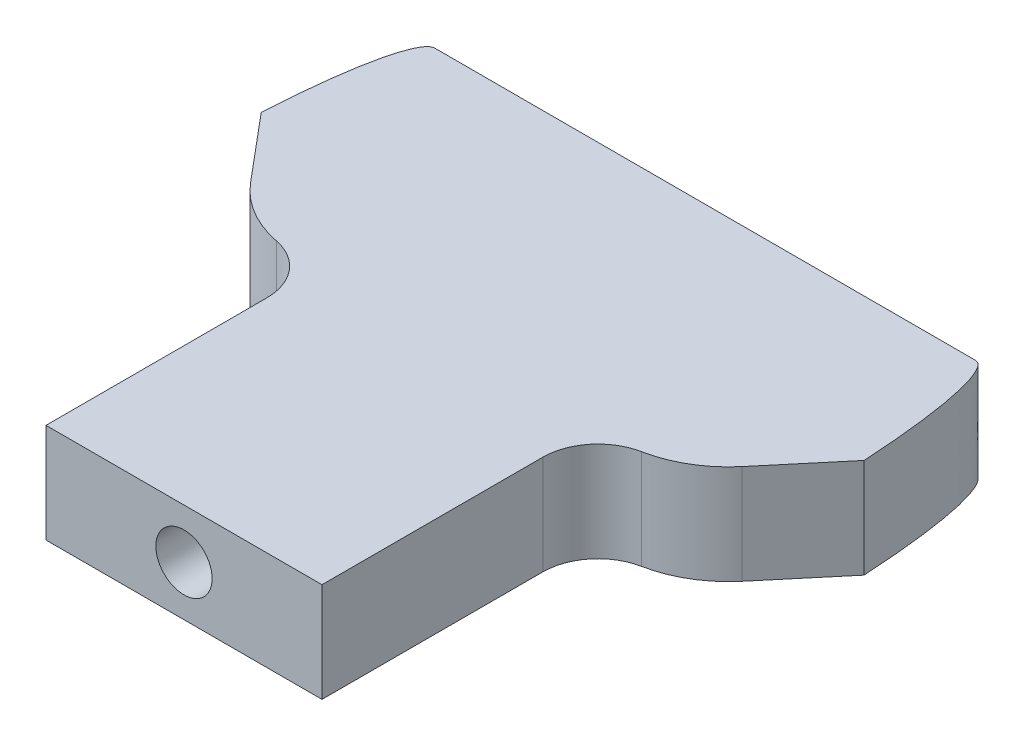
from build123d import *
from OCP.BRepFilletAPI import BRepFilletAPI_MakeChamfer

# Parameters (mm, degrees)
SKETCH2_W           = 55
SKETCH2_H           = 9
SKETCH2_R           = 2.55
BOSS_EXTRUDE1_DEPTH = 12.2
SKETCH3_W           = 55
SKETCH3_H           = 9
BOSS_EXTRUDE2_DEPTH = 35
CUT_EXTRUDE1_REACH  = 57.363
CHAMFER1_SIZE       = 8
CHAMFER1_SIZE2      = 9.534028741
FILLET1_SIZE        = 20
FILLET1_SIZE_2      = 3
FILLET2_R           = 10


with BuildPart() as part:
    # Sketch2 → Boss-Extrude1 (new body)
    with BuildSketch(Plane.XY):
        Rectangle(SKETCH2_W, SKETCH2_H)
        Circle(SKETCH2_R, mode=Mode.SUBTRACT)
    extrude(amount=-BOSS_EXTRUDE1_DEPTH)

    # Sketch3 → Boss-Extrude2 (add)
    with BuildSketch(Plane(origin=(0, 0, -12.2), x_dir=(-1, 0, 0), z_dir=(0, 0, -1))):
        Rectangle(SKETCH3_W, SKETCH3_H)
    extrude(amount=BOSS_EXTRUDE2_DEPTH)

    # Sketch5 → Cut-Extrude1 (cut, up to next)
    with BuildSketch(Plane.XZ.offset(4.5), mode=Mode.PRIVATE) as cut_extrude1_sk1:
        with BuildLine():
            Line((27.5, 0), (12.5, 0))
            Line((12.5, 0), (12.5, -20))
            ThreePointArc((12.5, -20), (13.964466094, -23.535533906), (17.5, -25))
            Line((17.5, -25), (27.5, -25))
            Line((27.5, -25), (27.5, 0))
        make_face()
    cut_extrude1_tool1 = extrude(cut_extrude1_sk1.sketch, amount=-CUT_EXTRUDE1_REACH, mode=Mode.PRIVATE) & part.part
    # Sketch5 → Cut-Extrude1 (cut, up to next)
    with BuildSketch(Plane.XZ.offset(4.5), mode=Mode.PRIVATE) as cut_extrude1_sk2:
        with BuildLine():
            Line((-12.5, 0), (-12.5, -20))
            ThreePointArc((-12.5, -20), (-13.964466094, -23.535533906), (-17.5, -25))
            Line((-17.5, -25), (-27.5, -25))
            Line((-27.5, -25), (-27.5, 0))
            Line((-27.5, 0), (-12.5, 0))
        make_face()
    cut_extrude1_tool2 = extrude(cut_extrude1_sk2.sketch, amount=-CUT_EXTRUDE1_REACH, mode=Mode.PRIVATE) & part.part
    add(cut_extrude1_tool1.solids().sort_by_distance((20.092648, -4.5, -12.33478))[0], mode=Mode.SUBTRACT)
    add(cut_extrude1_tool2.solids().sort_by_distance((-20.092648, -4.5, -12.33478))[0], mode=Mode.SUBTRACT)

    # Chamfer1: one chamfer whose edges measure the first distance from different faces: ONE call of the kernel's chamfer builder (chamfer() names one face for all edges)
    chamfer1_edges_1 = [part.edges().sort_by_distance(p)[0] for p in [
        (27.5, 0, -25),
    ]]
    chamfer1_side_1 = [part.faces().sort_by_distance(p)[0] for p in [
        (22.5, 0, -25),
    ]]
    chamfer1_edges_2 = [part.edges().sort_by_distance(p)[0] for p in [
        (-27.5, 0, -25),
    ]]
    chamfer1_side_2 = [part.faces().sort_by_distance(p)[0] for p in [
        (-22.5, 0, -25),
    ]]
    chamfer1 = BRepFilletAPI_MakeChamfer(part.part.solid().wrapped)
    for e in chamfer1_edges_1:
        chamfer1.Add(CHAMFER1_SIZE, CHAMFER1_SIZE2, e.wrapped, chamfer1_side_1[0].wrapped)  # the first distance lies on this face
    for e in chamfer1_edges_2:
        chamfer1.Add(CHAMFER1_SIZE, CHAMFER1_SIZE2, e.wrapped, chamfer1_side_2[0].wrapped)  # the first distance lies on this face
    add(Compound.cast(chamfer1.Shape()), mode=Mode.REPLACE)

    # Fillet1
    # an asymmetric fillet: 20, 3 mm, written as the material it takes off along each edge
    with BuildSketch(Plane(origin=(-27.5, -54.5, -47.2), x_dir=(0, 0, 1), z_dir=(0, 1, 0))) as fillet1_piece_1:
        with BuildLine():
            Bezier((FILLET1_SIZE, 0), (0, 0), (0, FILLET1_SIZE_2), weights=[1, 0.707106781, 1])
            Line((0, FILLET1_SIZE_2), (0, 0))
            Line((0, 0), (FILLET1_SIZE, 0))
        make_face()
    extrude(amount=109, mode=Mode.SUBTRACT)
    with BuildSketch(Plane(origin=(27.5, 54.5, -47.2), x_dir=(-1, 0, 0), z_dir=(0, -1, 0))) as fillet1_piece_2:
        with BuildLine():
            Bezier((FILLET1_SIZE_2, 0), (0, 0), (0, -FILLET1_SIZE), weights=[1, 0.707106781, 1])
            Line((0, -FILLET1_SIZE), (0, 0))
            Line((0, 0), (FILLET1_SIZE_2, 0))
        make_face()
    extrude(amount=109, mode=Mode.SUBTRACT)

    # Fillet2
    fillet2_edges = [part.edges().sort_by_distance(p)[0] for p in [
        (19.5, 0, -25),
        (-19.5, 0, -25),
    ]]
    fillet(fillet2_edges, radius=FILLET2_R)


solid = part.part
